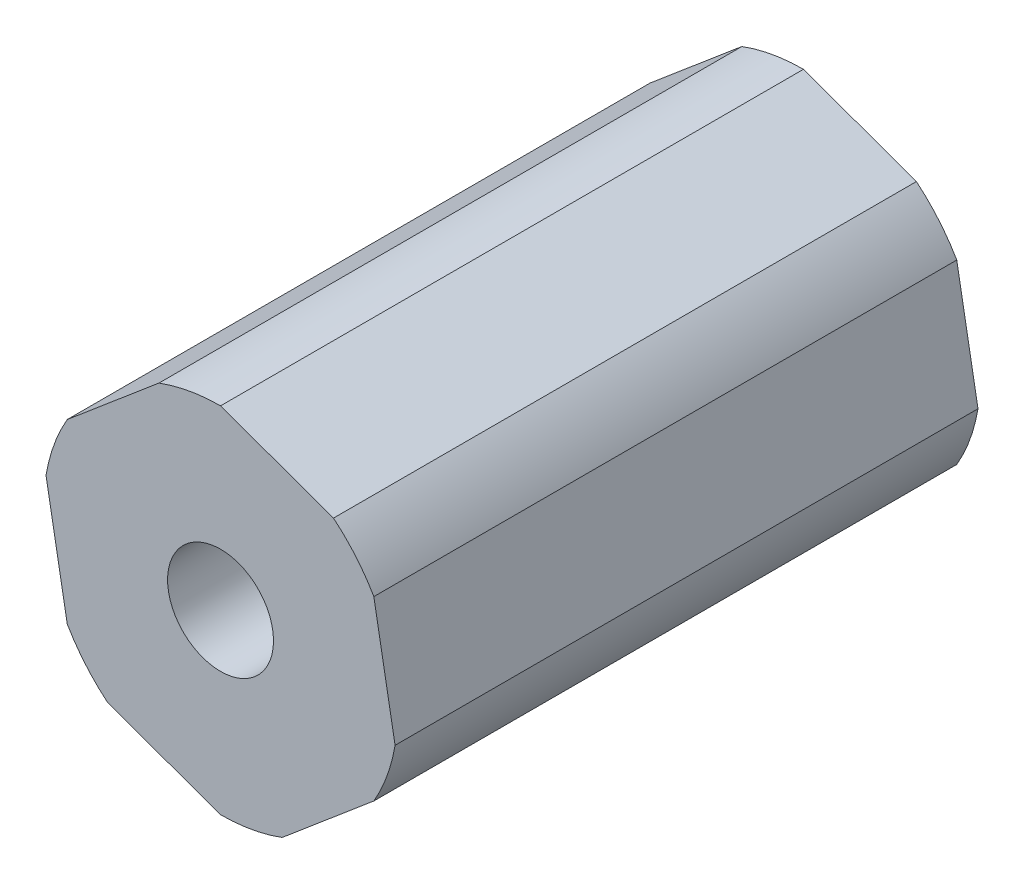
from build123d import *

# Parameters (mm, degrees)
BOSS_EXTRUDE1_DEPTH = 22.225
SKETCH2_R           = 2.0193
CUT_EXTRUDE1_DEPTH  = 25.161871589


with BuildPart() as part:
    # Sketch1 → Boss-Extrude1 (new body)
    with BuildSketch(Plane.XY):
        with BuildLine():
            Line((-6.654540832, 1.131188008), (-5.845671476, -3.375))
            ThreePointArc((-5.845671476, -3.375), (-5.15742276, -4.354709), (-4.306907968, -5.197407407))
            Line((-4.306907968, -5.197407407), (0, -6.75))
            ThreePointArc((0, -6.75), (1.19257724, -6.643813628), (2.347632865, -6.328595415))
            Line((2.347632865, -6.328595415), (5.845671476, -3.375))
            ThreePointArc((5.845671476, -3.375), (6.35, -2.289104628), (6.654540832, -1.131188008))
            Line((6.654540832, -1.131188008), (5.845671476, 3.375))
            ThreePointArc((5.845671476, 3.375), (5.15742276, 4.354709), (4.306907968, 5.197407407))
            Line((4.306907968, 5.197407407), (0, 6.75))
            ThreePointArc((0, 6.75), (-1.19257724, 6.643813628), (-2.347632865, 6.328595415))
            Line((-2.347632865, 6.328595415), (-5.845671476, 3.375))
            ThreePointArc((-5.845671476, 3.375), (-6.35, 2.289104628), (-6.654540832, 1.131188008))
        make_face()
    extrude(amount=BOSS_EXTRUDE1_DEPTH)

    # Sketch2 → Cut-Extrude1 (cut, through all)
    with BuildSketch(Plane.XY.offset(22.225)):
        Circle(SKETCH2_R)
    extrude(amount=-CUT_EXTRUDE1_DEPTH, mode=Mode.SUBTRACT)


solid = part.part
